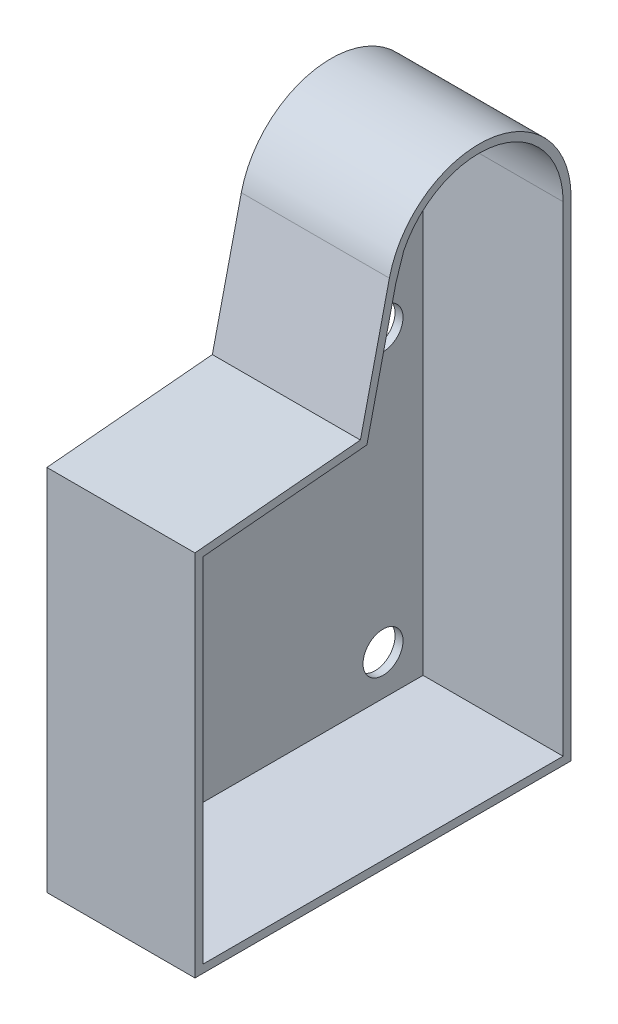
from build123d import *

# Parameters (mm, degrees)
SKETCH1_R           = 5
BOSS_EXTRUDE1_DEPTH = 2
EXTRUDE_THIN1_START = 35
EXTRUDE_THIN1_DEPTH = 35


with BuildPart() as part:
    # Sketch1 → Boss-Extrude1 (new body)
    with BuildSketch(Plane(origin=(0, 0, 0), x_dir=(0, 0, -1), z_dir=(1, 0, 0))):
        with BuildLine():
            Line((49.043932947, -59.7371598), (-44.956067053, -59.7371598))
            Line((-44.956067053, -59.7371598), (-44.956067053, 32.2628402))
            Line((-44.956067053, 32.2628402), (-3.612044261, 36.014733483))
            Line((-3.612044261, 36.014733483), (3.632035406, 67.43070713))
            ThreePointArc((3.632035406, 67.43070713), (28.644544082, 85.115341633), (49.043932947, 62.2628402))
            Line((49.043932947, 62.2628402), (49.043932947, -59.7371598))
        make_face()
        with Locations((37.043932947, 22.2628402)):
            Circle(SKETCH1_R, mode=Mode.SUBTRACT)
        with Locations((37.043932947, -47.7371598)):
            Circle(SKETCH1_R, mode=Mode.SUBTRACT)
        with Locations((-32.956067053, -47.7371598)):
            Circle(SKETCH1_R, mode=Mode.SUBTRACT)
        with Locations((-32.956067053, 22.2628402)):
            Circle(SKETCH1_R, mode=Mode.SUBTRACT)
    extrude(amount=-BOSS_EXTRUDE1_DEPTH)

    # Sketch2 → Extrude-Thin1 (add)
    # profile 1 of 2: a face of its own
    with BuildSketch(Plane(origin=(0, 0, 0), x_dir=(0, 0, -1), z_dir=(1, 0, 0)).offset(EXTRUDE_THIN1_START)):
        with BuildLine():
            Line((-3.612044261, 36.014733483), (3.632035406, 67.43070713))
            ThreePointArc((3.632035406, 67.43070713), (28.644544082, 85.115341633), (49.043932947, 62.2628402))
            Line((49.043932947, 62.2628402), (49.043932947, -59.7371598))
            Line((49.043932947, -59.7371598), (-44.956067053, -59.7371598))
            Line((-44.956067053, -59.7371598), (-44.956067053, 32.2628402))
            Line((-44.956067053, 32.2628402), (-42.956067053, 32.2628402))
            Line((-42.956067053, 32.2628402), (-42.956067053, -57.7371598))
            Line((-42.956067053, -57.7371598), (47.043932947, -57.7371598))
            Line((47.043932947, -57.7371598), (47.043932947, 62.2628402))
            ThreePointArc((47.043932947, 62.2628402), (28.418403983, 83.128167595), (5.580896061, 66.981327397))
            Line((5.580896061, 66.981327397), (-1.663183605, 35.56535375))
            Line((-1.663183605, 35.56535375), (-3.612044261, 36.014733483))
        make_face()
    # profile 2 of 2: a face of its own
    with BuildSketch(Plane(origin=(0, 0, 0), x_dir=(0, 0, -1), z_dir=(1, 0, 0)).offset(EXTRUDE_THIN1_START)):
        with BuildLine():
            Line((49.043932947, 62.2628402), (49.043932947, -59.7371598))
            Line((49.043932947, -59.7371598), (-44.956067053, -59.7371598))
            Line((-44.956067053, -59.7371598), (-44.956067053, 32.2628402))
            Line((-44.956067053, 32.2628402), (-3.612044261, 36.014733483))
            Line((-3.612044261, 36.014733483), (3.326726289, 66.10664892))
            Line((3.326726289, 66.10664892), (5.362716863, 72.326999445))
            ThreePointArc((5.362716863, 72.326999445), (31.207847648, 84.675648702), (49.043932947, 62.2628402))
        make_face()
        with BuildLine():
            Line((47.043932947, 62.2628402), (47.043932947, -57.7371598))
            Line((47.043932947, -57.7371598), (-42.956067053, -57.7371598))
            Line((-42.956067053, -57.7371598), (-42.956067053, 30.436118145))
            Line((-42.956067053, 30.436118145), (-1.988660061, 34.153834244))
            Line((-1.988660061, 34.153834244), (5.255419606, 65.569807891))
            Line((5.255419606, 65.569807891), (7.219966056, 71.571882604))
            ThreePointArc((7.219966056, 71.571882604), (30.82392747, 82.711596944), (47.043932947, 62.2628402))
        make_face(mode=Mode.SUBTRACT)
    extrude(amount=-EXTRUDE_THIN1_DEPTH)


solid = part.part
